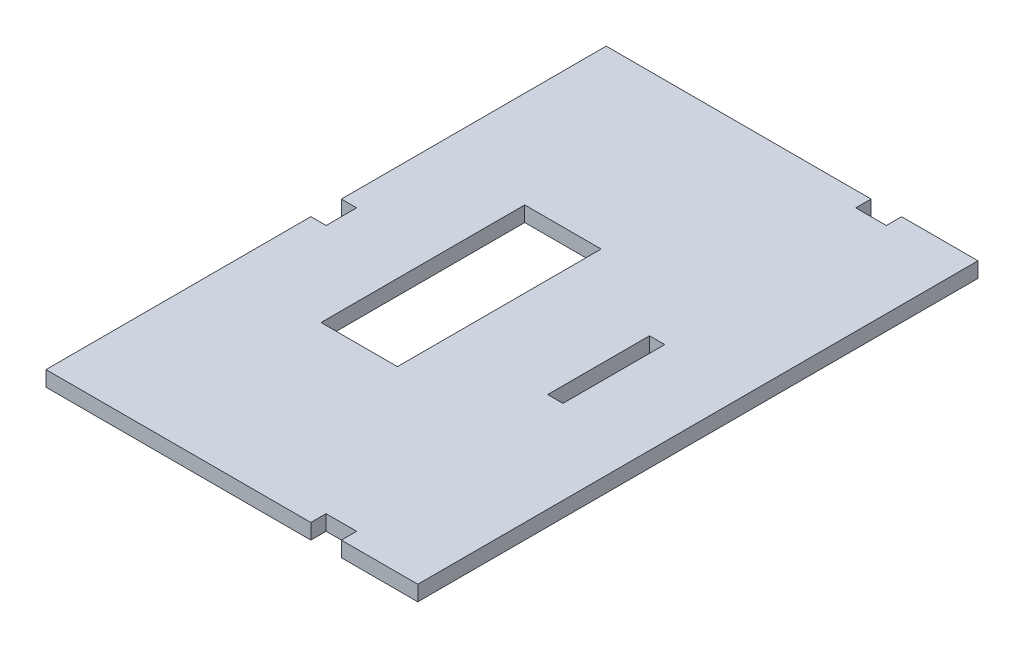
from build123d import *

# Parameters (mm, degrees)
EXTRUDE_3_DEPTH    = 3
SKETCH1_W          = 15
SKETCH1_H          = 40
SKETCH1_W_2        = 3
SKETCH1_H_2        = 20
CUT_EXTRUDE1_DEPTH = 10


with BuildPart() as part:
    # Эскиз4 → Бобышка-Вытянуть3 (new body)
    with BuildSketch(Plane(origin=(0, 0, 0), x_dir=(1, 0, 0), z_dir=(0, 1, 0))):
        Polygon((0, 110), (0, 58), (3, 58), (3, 52), (0, 52), (0, 0), (52, 0), (52, 3), (58, 3), (58, 0), (73, 0), (73, 110), (58, 110), (58, 107), (52, 107), (52, 110), align=None)
    extrude(amount=EXTRUDE_3_DEPTH)

    # Sketch1 → Cut-Extrude1 (cut)
    with BuildSketch(Plane(origin=(0, 3, 0), x_dir=(1, 0, 0), z_dir=(0, 1, 0))):
        with Locations((26.5, 55)):
            Rectangle(SKETCH1_W, SKETCH1_H)
        with Locations((55, 55)):
            Rectangle(SKETCH1_W_2, SKETCH1_H_2)
    extrude(amount=-CUT_EXTRUDE1_DEPTH, mode=Mode.SUBTRACT)


solid = part.part
